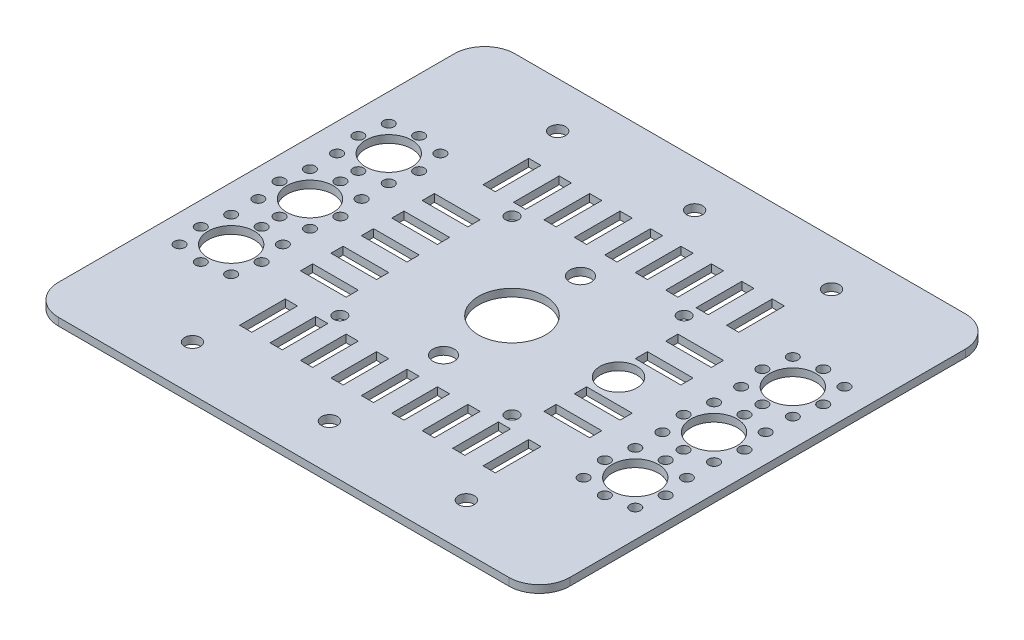
from build123d import *

# Parameters (mm, degrees)
SM_BASE_FLANGE_1_DEPTH = 110
CUT_EXTRUDE_4_REACH    = 217.245
SKETCH_10_R            = 11
CUT_EXTRUDE_5_REACH    = 217.245
SKETCH_11_R            = 2.1
CUT_EXTRUDE_9_REACH    = 215.598
SKETCH_20_R            = 1.6
SKETCH_38_R            = 7.6
SKETCH_38_R_2          = 1.75
CUT_EXTRUDE_15_DEPTH   = 10
SKETCH_39_W            = 21
SKETCH_39_H            = 110
CUT_EXTRUDE_16_DEPTH   = 240
SKETCH_40_W            = 17
SKETCH_40_H            = 110
SKETCH_40_R            = 2.6
EXTRUDE_2_DEPTH        = 2.5
SKETCH_41_R            = 3.5
SKETCH_41_R_2          = 6.1
CUT_EXTRUDE_17_DEPTH   = 240
SKETCH_42_W            = 228
SKETCH_42_H            = 20
EXTRUDE_5_DEPTH        = 2.5
SKETCH_43_R            = 2.6
CUT_EXTRUDE_18_DEPTH   = 10
SKETCH_44_W            = 30
SKETCH_44_H            = 150
SKETCH_44_R            = 2.6
CUT_EXTRUDE_19_DEPTH   = 10
FILLET_2_R             = 10
SKETCH_45_W            = 4
SKETCH_45_H            = 15
SKETCH_45_W_2          = 15
SKETCH_45_H_2          = 4
CUT_EXTRUDE_20_DEPTH   = 10


# Sheet-metal steps are written as plain solids
with BuildPart() as part:
    # Sketch 1 → 基体-法兰1 (new body)
    with BuildSketch(Plane.XY):
        with BuildLine():
            Line((-118, -140), (-103.5, -140))
            ThreePointArc((-103.5, -140), (-100.318019485, -138.681980515), (-99, -135.5))
            Line((-99, -135.5), (-99, -2))
            ThreePointArc((-99, -2), (-98.414213562, -0.585786438), (-97, 0))
            Line((-97, 0), (97, 0))
            ThreePointArc((97, 0), (98.414213562, -0.585786438), (99, -2))
            Line((99, -2), (99, -135.5))
            ThreePointArc((99, -135.5), (100.318019485, -138.681980515), (103.5, -140))
            Line((103.5, -140), (118, -140))
            Line((118, -140), (118, -137.5))
            Line((118, -137.5), (103.5, -137.5))
            ThreePointArc((103.5, -137.5), (102.085786438, -136.914213562), (101.5, -135.5))
            Line((101.5, -135.5), (101.5, -2))
            ThreePointArc((101.5, -2), (100.181980515, 1.181980515), (97, 2.5))
            Line((97, 2.5), (-97, 2.5))
            ThreePointArc((-97, 2.5), (-100.181980515, 1.181980515), (-101.5, -2))
            Line((-101.5, -2), (-101.5, -135.5))
            ThreePointArc((-101.5, -135.5), (-102.085786438, -136.914213562), (-103.5, -137.5))
            Line((-103.5, -137.5), (-118, -137.5))
            Line((-118, -137.5), (-118, -140))
        make_face()
    extrude(amount=SM_BASE_FLANGE_1_DEPTH)

    # 草图10 → 切除-拉伸4 (cut, up to next)
    with BuildSketch(Plane(origin=(0, 2.5, 0), x_dir=(1, 0, 0), z_dir=(0, 1, 0)), mode=Mode.PRIVATE) as cut_extrude_4_sk1:
        with Locations(Location((0, -55, 0), (0, 0, 270))):
            Circle(SKETCH_10_R)
    cut_extrude_4_tool1 = extrude(cut_extrude_4_sk1.sketch, amount=-CUT_EXTRUDE_4_REACH, mode=Mode.PRIVATE) & part.part
    add(cut_extrude_4_tool1.solids().sort_by_distance((0, 2.5, 55))[0], mode=Mode.SUBTRACT)

    # 草图11 → 切除-拉伸5 (cut, up to next)
    with BuildSketch(Plane(origin=(0, 2.5, 0), x_dir=(1, 0, 0), z_dir=(0, 1, 0)), mode=Mode.PRIVATE) as cut_extrude_5_sk1:
        with Locations(Location((-28.284271247, -83.284271247, 0), (0, 0, 270))):
            Circle(SKETCH_11_R)
    cut_extrude_5_tool1 = extrude(cut_extrude_5_sk1.sketch, amount=-CUT_EXTRUDE_5_REACH, mode=Mode.PRIVATE) & part.part
    # 草图11 → 切除-拉伸5 (cut, up to next)
    with BuildSketch(Plane(origin=(0, 2.5, 0), x_dir=(1, 0, 0), z_dir=(0, 1, 0)), mode=Mode.PRIVATE) as cut_extrude_5_sk2:
        with Locations(Location((28.284271247, -83.284271247, 0), (0, 0, 270))):
            Circle(SKETCH_11_R)
    cut_extrude_5_tool2 = extrude(cut_extrude_5_sk2.sketch, amount=-CUT_EXTRUDE_5_REACH, mode=Mode.PRIVATE) & part.part
    # 草图11 → 切除-拉伸5 (cut, up to next)
    with BuildSketch(Plane(origin=(0, 2.5, 0), x_dir=(1, 0, 0), z_dir=(0, 1, 0)), mode=Mode.PRIVATE) as cut_extrude_5_sk3:
        with Locations(Location((-28.284271247, -26.715728753, 0), (0, 0, 270))):
            Circle(SKETCH_11_R)
    cut_extrude_5_tool3 = extrude(cut_extrude_5_sk3.sketch, amount=-CUT_EXTRUDE_5_REACH, mode=Mode.PRIVATE) & part.part
    # 草图11 → 切除-拉伸5 (cut, up to next)
    with BuildSketch(Plane(origin=(0, 2.5, 0), x_dir=(1, 0, 0), z_dir=(0, 1, 0)), mode=Mode.PRIVATE) as cut_extrude_5_sk4:
        with Locations(Location((28.284271247, -26.715728753, 0), (0, 0, 270))):
            Circle(SKETCH_11_R)
    cut_extrude_5_tool4 = extrude(cut_extrude_5_sk4.sketch, amount=-CUT_EXTRUDE_5_REACH, mode=Mode.PRIVATE) & part.part
    add(cut_extrude_5_tool1.solids().sort_by_distance((-28.284271, 2.5, 83.284271))[0], mode=Mode.SUBTRACT)
    add(cut_extrude_5_tool2.solids().sort_by_distance((28.284271, 2.5, 83.284271))[0], mode=Mode.SUBTRACT)
    add(cut_extrude_5_tool3.solids().sort_by_distance((-28.284271, 2.5, 26.715729))[0], mode=Mode.SUBTRACT)
    add(cut_extrude_5_tool4.solids().sort_by_distance((28.284271, 2.5, 26.715729))[0], mode=Mode.SUBTRACT)

    # 草图20 → 切除-拉伸9 (cut, up to next)
    with BuildSketch(Plane(origin=(0, -137.5, 0), x_dir=(1, 0, 0), z_dir=(0, 1, 0)), mode=Mode.PRIVATE) as cut_extrude_9_sk1:
        with Locations(Location((-110.75, -55, 0), (0, 0, 180))):
            Circle(SKETCH_20_R)
    cut_extrude_9_tool1 = extrude(cut_extrude_9_sk1.sketch, amount=-CUT_EXTRUDE_9_REACH, mode=Mode.PRIVATE) & part.part
    # 草图20 → 切除-拉伸9 (cut, up to next)
    with BuildSketch(Plane(origin=(0, -137.5, 0), x_dir=(1, 0, 0), z_dir=(0, 1, 0)), mode=Mode.PRIVATE) as cut_extrude_9_sk2:
        with Locations(Location((-110.75, -15, 0), (0, 0, 180))):
            Circle(SKETCH_20_R)
    cut_extrude_9_tool2 = extrude(cut_extrude_9_sk2.sketch, amount=-CUT_EXTRUDE_9_REACH, mode=Mode.PRIVATE) & part.part
    # 草图20 → 切除-拉伸9 (cut, up to next)
    with BuildSketch(Plane(origin=(0, -137.5, 0), x_dir=(1, 0, 0), z_dir=(0, 1, 0)), mode=Mode.PRIVATE) as cut_extrude_9_sk3:
        with Locations((-110.75, -95)):
            Circle(SKETCH_20_R)
    cut_extrude_9_tool3 = extrude(cut_extrude_9_sk3.sketch, amount=-CUT_EXTRUDE_9_REACH, mode=Mode.PRIVATE) & part.part
    # 草图20 → 切除-拉伸9 (cut, up to next)
    with BuildSketch(Plane(origin=(0, -137.5, 0), x_dir=(1, 0, 0), z_dir=(0, 1, 0)), mode=Mode.PRIVATE) as cut_extrude_9_sk4:
        with Locations(Location((110.75, -55, 0), (0, 0, 180))):
            Circle(SKETCH_20_R)
    cut_extrude_9_tool4 = extrude(cut_extrude_9_sk4.sketch, amount=-CUT_EXTRUDE_9_REACH, mode=Mode.PRIVATE) & part.part
    # 草图20 → 切除-拉伸9 (cut, up to next)
    with BuildSketch(Plane(origin=(0, -137.5, 0), x_dir=(1, 0, 0), z_dir=(0, 1, 0)), mode=Mode.PRIVATE) as cut_extrude_9_sk5:
        with Locations(Location((110.75, -15, 0), (0, 0, 180))):
            Circle(SKETCH_20_R)
    cut_extrude_9_tool5 = extrude(cut_extrude_9_sk5.sketch, amount=-CUT_EXTRUDE_9_REACH, mode=Mode.PRIVATE) & part.part
    # 草图20 → 切除-拉伸9 (cut, up to next)
    with BuildSketch(Plane(origin=(0, -137.5, 0), x_dir=(1, 0, 0), z_dir=(0, 1, 0)), mode=Mode.PRIVATE) as cut_extrude_9_sk6:
        with Locations(Location((110.75, -95, 0), (0, 0, 90))):
            Circle(SKETCH_20_R)
    cut_extrude_9_tool6 = extrude(cut_extrude_9_sk6.sketch, amount=-CUT_EXTRUDE_9_REACH, mode=Mode.PRIVATE) & part.part
    add(cut_extrude_9_tool1.solids().sort_by_distance((-110.75, -137.5, 55))[0], mode=Mode.SUBTRACT)
    add(cut_extrude_9_tool2.solids().sort_by_distance((-110.75, -137.5, 15))[0], mode=Mode.SUBTRACT)
    add(cut_extrude_9_tool3.solids().sort_by_distance((-110.75, -137.5, 95))[0], mode=Mode.SUBTRACT)
    add(cut_extrude_9_tool4.solids().sort_by_distance((110.75, -137.5, 55))[0], mode=Mode.SUBTRACT)
    add(cut_extrude_9_tool5.solids().sort_by_distance((110.75, -137.5, 15))[0], mode=Mode.SUBTRACT)
    add(cut_extrude_9_tool6.solids().sort_by_distance((110.75, -137.5, 95))[0], mode=Mode.SUBTRACT)

    # 草图38 → 切除-拉伸15 (cut)
    with BuildSketch(Plane(origin=(0, 2.5, 0), x_dir=(1, 0, 0), z_dir=(0, 1, 0))):
        with Locations(Location((-66.382990642, -29.117009358, 0), (0, 0, 270))):
            Circle(SKETCH_38_R)
        with Locations(Location((-74.868272016, -37.602290732, 0), (0, 0, 270))):
            Circle(SKETCH_38_R_2)
        with Locations(Location((-74.868272016, -20.631727984, 0), (0, 0, 270))):
            Circle(SKETCH_38_R_2)
        with Locations(Location((-57.897709268, -37.602290732, 0), (0, 0, 270))):
            Circle(SKETCH_38_R_2)
        with Locations(Location((-57.897709268, -20.631727984, 0), (0, 0, 270))):
            Circle(SKETCH_38_R_2)
        with Locations(Location((57.897709268, -20.631727984, 0), (0, 0, 90))):
            Circle(SKETCH_38_R_2)
        with Locations(Location((57.897709268, -37.602290732, 0), (0, 0, 90))):
            Circle(SKETCH_38_R_2)
        with Locations(Location((74.868272016, -20.631727984, 0), (0, 0, 90))):
            Circle(SKETCH_38_R_2)
        with Locations(Location((74.868272016, -37.602290732, 0), (0, 0, 90))):
            Circle(SKETCH_38_R_2)
        with Locations(Location((66.382990642, -29.117009358, 0), (0, 0, 90))):
            Circle(SKETCH_38_R)
        with Locations(Location((66.382990642, -80.882990642, 0), (0, 0, 270))):
            Circle(SKETCH_38_R)
        with Locations(Location((74.868272016, -72.397709268, 0), (0, 0, 270))):
            Circle(SKETCH_38_R_2)
        with Locations(Location((74.868272016, -89.368272016, 0), (0, 0, 270))):
            Circle(SKETCH_38_R_2)
        with Locations(Location((57.897709268, -72.397709268, 0), (0, 0, 270))):
            Circle(SKETCH_38_R_2)
        with Locations(Location((57.897709268, -89.368272016, 0), (0, 0, 270))):
            Circle(SKETCH_38_R_2)
        with Locations(Location((-57.897709268, -89.368272016, 0), (0, 0, 90))):
            Circle(SKETCH_38_R_2)
        with Locations(Location((-57.897709268, -72.397709268, 0), (0, 0, 90))):
            Circle(SKETCH_38_R_2)
        with Locations(Location((-74.868272016, -89.368272016, 0), (0, 0, 90))):
            Circle(SKETCH_38_R_2)
        with Locations(Location((-74.868272016, -72.397709268, 0), (0, 0, 90))):
            Circle(SKETCH_38_R_2)
        with Locations(Location((-66.382990642, -80.882990642, 0), (0, 0, 90))):
            Circle(SKETCH_38_R)
        with Locations(Location((-66.382990642, -19.117009358, 0), (0, 0, 270))):
            Circle(SKETCH_38_R_2)
        with Locations(Location((-66.382990642, -39.117009358, 0), (0, 0, 270))):
            Circle(SKETCH_38_R_2)
        with Locations(Location((-76.382990642, -29.117009358, 0), (0, 0, 270))):
            Circle(SKETCH_38_R_2)
        with Locations(Location((-56.382990642, -29.117009358, 0), (0, 0, 270))):
            Circle(SKETCH_38_R_2)
        with Locations(Location((66.382990642, -39.117009358, 0), (0, 0, 90))):
            Circle(SKETCH_38_R_2)
        with Locations(Location((56.382990642, -29.117009358, 0), (0, 0, 90))):
            Circle(SKETCH_38_R_2)
        with Locations(Location((76.382990642, -29.117009358, 0), (0, 0, 90))):
            Circle(SKETCH_38_R_2)
        with Locations(Location((66.382990642, -19.117009358, 0), (0, 0, 90))):
            Circle(SKETCH_38_R_2)
        with Locations(Location((76.382990642, -80.882990642, 0), (0, 0, 270))):
            Circle(SKETCH_38_R_2)
        with Locations(Location((66.382990642, -70.882990642, 0), (0, 0, 270))):
            Circle(SKETCH_38_R_2)
        with Locations(Location((56.382990642, -80.882990642, 0), (0, 0, 270))):
            Circle(SKETCH_38_R_2)
        with Locations(Location((66.382990642, -90.882990642, 0), (0, 0, 270))):
            Circle(SKETCH_38_R_2)
        with Locations(Location((-56.382990642, -80.882990642, 0), (0, 0, 90))):
            Circle(SKETCH_38_R_2)
        with Locations(Location((-66.382990642, -70.882990642, 0), (0, 0, 90))):
            Circle(SKETCH_38_R_2)
        with Locations(Location((-76.382990642, -80.882990642, 0), (0, 0, 90))):
            Circle(SKETCH_38_R_2)
        with Locations(Location((-66.382990642, -90.882990642, 0), (0, 0, 90))):
            Circle(SKETCH_38_R_2)
        with Locations(Location((-66.382990642, -45, 0), (0, 0, 270))):
            Circle(SKETCH_38_R_2)
        with Locations(Location((-76.382990642, -55, 0), (0, 0, 270))):
            Circle(SKETCH_38_R_2)
        with Locations(Location((-66.382990642, -65, 0), (0, 0, 270))):
            Circle(SKETCH_38_R_2)
        with Locations(Location((-56.382990642, -55, 0), (0, 0, 270))):
            Circle(SKETCH_38_R_2)
        with Locations(Location((-66.382990642, -55, 0), (0, 0, 270))):
            Circle(SKETCH_38_R)
        with Locations(Location((-74.868272016, -63.485281374, 0), (0, 0, 270))):
            Circle(SKETCH_38_R_2)
        with Locations(Location((-74.868272016, -46.514718626, 0), (0, 0, 270))):
            Circle(SKETCH_38_R_2)
        with Locations(Location((-57.897709268, -63.485281374, 0), (0, 0, 270))):
            Circle(SKETCH_38_R_2)
        with Locations(Location((-57.897709268, -46.514718626, 0), (0, 0, 270))):
            Circle(SKETCH_38_R_2)
        with Locations(Location((57.897709268, -46.514718626, 0), (0, 0, 90))):
            Circle(SKETCH_38_R_2)
        with Locations(Location((57.897709268, -63.485281374, 0), (0, 0, 90))):
            Circle(SKETCH_38_R_2)
        with Locations(Location((74.868272016, -46.514718626, 0), (0, 0, 90))):
            Circle(SKETCH_38_R_2)
        with Locations(Location((74.868272016, -63.485281374, 0), (0, 0, 90))):
            Circle(SKETCH_38_R_2)
        with Locations(Location((66.382990642, -55, 0), (0, 0, 90))):
            Circle(SKETCH_38_R)
        with Locations(Location((56.382990642, -55, 0), (0, 0, 90))):
            Circle(SKETCH_38_R_2)
        with Locations(Location((66.382990642, -65, 0), (0, 0, 90))):
            Circle(SKETCH_38_R_2)
        with Locations(Location((76.382990642, -55, 0), (0, 0, 90))):
            Circle(SKETCH_38_R_2)
        with Locations(Location((66.382990642, -45, 0), (0, 0, 90))):
            Circle(SKETCH_38_R_2)
    extrude(amount=-CUT_EXTRUDE_15_DEPTH, mode=Mode.SUBTRACT)

    # 草图39 → 切除-拉伸16 (cut)
    with BuildSketch(Plane(origin=(0, 2.5, 0), x_dir=(1, 0, 0), z_dir=(0, 1, 0))):
        with Locations((-107.5, -55)):
            Rectangle(SKETCH_39_W, SKETCH_39_H)
        with Locations((107.5, -55)):
            Rectangle(SKETCH_39_W, SKETCH_39_H)
    extrude(amount=-CUT_EXTRUDE_16_DEPTH, mode=Mode.SUBTRACT)

    # 草图40 → Extrude 2 (add)
    # profile 1 of 2: a face of its own
    with BuildSketch(Plane(origin=(0, 2.5, 0), x_dir=(1, 0, 0), z_dir=(0, 1, 0))):
        with Locations((-105.5, -55)):
            Rectangle(SKETCH_40_W, SKETCH_40_H)
        with Locations(Location((-100, -55, 0), (0, 0, 270))):
            Circle(SKETCH_40_R, mode=Mode.SUBTRACT)
        with Locations(Location((-100, -15, 0), (0, 0, 270))):
            Circle(SKETCH_40_R, mode=Mode.SUBTRACT)
        with Locations(Location((-100, -95, 0), (0, 0, 270))):
            Circle(SKETCH_40_R, mode=Mode.SUBTRACT)
    # profile 2 of 2: a face of its own
    with BuildSketch(Plane(origin=(0, 2.5, 0), x_dir=(1, 0, 0), z_dir=(0, 1, 0))):
        with Locations((105.5, -55)):
            Rectangle(SKETCH_40_W, SKETCH_40_H)
        with Locations(Location((100, -95, 0), (0, 0, 270))):
            Circle(SKETCH_40_R, mode=Mode.SUBTRACT)
        with Locations(Location((100, -15, 0), (0, 0, 270))):
            Circle(SKETCH_40_R, mode=Mode.SUBTRACT)
        with Locations(Location((100, -55, 0), (0, 0, 270))):
            Circle(SKETCH_40_R, mode=Mode.SUBTRACT)
    extrude(amount=-EXTRUDE_2_DEPTH)

    # 草图41 → 切除-拉伸17 (cut)
    with BuildSketch(Plane(origin=(0, 2.5, 0), x_dir=(1, 0, 0), z_dir=(0, 1, 0))):
        with Locations(Location((0, -32.5, 0), (0, 0, 270))):
            Circle(SKETCH_41_R)
        with Locations(Location((0, -77.5, 0), (0, 0, 270))):
            Circle(SKETCH_41_R)
        with Locations(Location((35, -55, 0), (0, 0, 270))):
            Circle(SKETCH_41_R_2)
    extrude(amount=-CUT_EXTRUDE_17_DEPTH, mode=Mode.SUBTRACT)

    # 草图42 → Extrude 5 (add)
    with BuildSketch(Plane(origin=(0, 2.5, 0), x_dir=(1, 0, 0), z_dir=(0, 1, 0))):
        with Locations((0, 10)):
            Rectangle(SKETCH_42_W, SKETCH_42_H)
        with Locations((0, -120)):
            Rectangle(SKETCH_42_W, SKETCH_42_H)
    extrude(amount=-EXTRUDE_5_DEPTH)

    # 草图43 → 切除-拉伸18 (cut)
    with BuildSketch(Plane(origin=(0, 2.5, 0), x_dir=(1, 0, 0), z_dir=(0, 1, 0))):
        with Locations(Location((-45, -115, 0), (0, 0, 270))):
            Circle(SKETCH_43_R)
        with Locations(Location((0, -115, 0), (0, 0, 270))):
            Circle(SKETCH_43_R)
        with Locations(Location((45, -115, 0), (0, 0, 270))):
            Circle(SKETCH_43_R)
        with Locations(Location((45, 5, 0), (0, 0, 270))):
            Circle(SKETCH_43_R)
        with Locations(Location((0, 5, 0), (0, 0, 270))):
            Circle(SKETCH_43_R)
        with Locations(Location((-45, 5, 0), (0, 0, 270))):
            Circle(SKETCH_43_R)
    extrude(amount=-CUT_EXTRUDE_18_DEPTH, mode=Mode.SUBTRACT)

    # 草图44 → 切除-拉伸19 (cut)
    # profile 1 of 2: a face of its own
    with BuildSketch(Plane(origin=(0, 2.5, 0), x_dir=(1, 0, 0), z_dir=(0, 1, 0))):
        with Locations((-99, -55)):
            Rectangle(SKETCH_44_W, SKETCH_44_H)
        with Locations((-100, -95)):
            Circle(SKETCH_44_R, mode=Mode.SUBTRACT)
        with Locations((-100, -55)):
            Circle(SKETCH_44_R, mode=Mode.SUBTRACT)
        with Locations((-100, -15)):
            Circle(SKETCH_44_R, mode=Mode.SUBTRACT)
    # profile 2 of 2: a face of its own
    with BuildSketch(Plane(origin=(0, 2.5, 0), x_dir=(1, 0, 0), z_dir=(0, 1, 0))):
        with Locations((99, -55)):
            Rectangle(SKETCH_44_W, SKETCH_44_H)
        with Locations((100, -95)):
            Circle(SKETCH_44_R, mode=Mode.SUBTRACT)
        with Locations((100, -55)):
            Circle(SKETCH_44_R, mode=Mode.SUBTRACT)
        with Locations((100, -15)):
            Circle(SKETCH_44_R, mode=Mode.SUBTRACT)
    extrude(amount=-CUT_EXTRUDE_19_DEPTH, mode=Mode.SUBTRACT)

    # 圆角2
    fillet_2_edges = [part.edges().sort_by_distance(p)[0] for p in [
        (84, 1.25, -20),
        (84, 1.25, 130),
        (-84, 1.25, -20),
        (-84, 1.25, 130),
    ]]
    fillet(fillet_2_edges, radius=FILLET_2_R)

    # 草图45 → 切除-拉伸20 (cut)
    with BuildSketch(Plane(origin=(0, 2.5, 0), x_dir=(1, 0, 0), z_dir=(0, 1, 0))):
        with Locations((-30, -15)):
            Rectangle(SKETCH_45_W, SKETCH_45_H)
        with Locations((-40, -15)):
            Rectangle(SKETCH_45_W, SKETCH_45_H)
        with Locations((-20, -15)):
            Rectangle(SKETCH_45_W, SKETCH_45_H)
        with Locations((-10, -15)):
            Rectangle(SKETCH_45_W, SKETCH_45_H)
        with Locations((0, -15)):
            Rectangle(SKETCH_45_W, SKETCH_45_H)
        with Locations((10, -15)):
            Rectangle(SKETCH_45_W, SKETCH_45_H)
        with Locations((20, -15)):
            Rectangle(SKETCH_45_W, SKETCH_45_H)
        with Locations((30, -15)):
            Rectangle(SKETCH_45_W, SKETCH_45_H)
        with Locations((40, -15)):
            Rectangle(SKETCH_45_W, SKETCH_45_H)
        with Locations((40, -95)):
            Rectangle(SKETCH_45_W, SKETCH_45_H)
        with Locations((30, -95)):
            Rectangle(SKETCH_45_W, SKETCH_45_H)
        with Locations((20, -95)):
            Rectangle(SKETCH_45_W, SKETCH_45_H)
        with Locations((10, -95)):
            Rectangle(SKETCH_45_W, SKETCH_45_H)
        with Locations((0, -95)):
            Rectangle(SKETCH_45_W, SKETCH_45_H)
        with Locations((-10, -95)):
            Rectangle(SKETCH_45_W, SKETCH_45_H)
        with Locations((-20, -95)):
            Rectangle(SKETCH_45_W, SKETCH_45_H)
        with Locations((-30, -95)):
            Rectangle(SKETCH_45_W, SKETCH_45_H)
        with Locations((-40, -95)):
            Rectangle(SKETCH_45_W, SKETCH_45_H)
        with Locations((-40, -45)):
            Rectangle(SKETCH_45_W_2, SKETCH_45_H_2)
        with Locations((-40, -55)):
            Rectangle(SKETCH_45_W_2, SKETCH_45_H_2)
        with Locations((-40, -35)):
            Rectangle(SKETCH_45_W_2, SKETCH_45_H_2)
        with Locations((-40, -65)):
            Rectangle(SKETCH_45_W_2, SKETCH_45_H_2)
        with Locations((-40, -75)):
            Rectangle(SKETCH_45_W_2, SKETCH_45_H_2)
        with Locations((40, -75)):
            Rectangle(SKETCH_45_W_2, SKETCH_45_H_2)
        with Locations((40, -65)):
            Rectangle(SKETCH_45_W_2, SKETCH_45_H_2)
        with Locations((40, -35)):
            Rectangle(SKETCH_45_W_2, SKETCH_45_H_2)
        with Locations((40, -45)):
            Rectangle(SKETCH_45_W_2, SKETCH_45_H_2)
    extrude(amount=-CUT_EXTRUDE_20_DEPTH, mode=Mode.SUBTRACT)


solid = part.part
